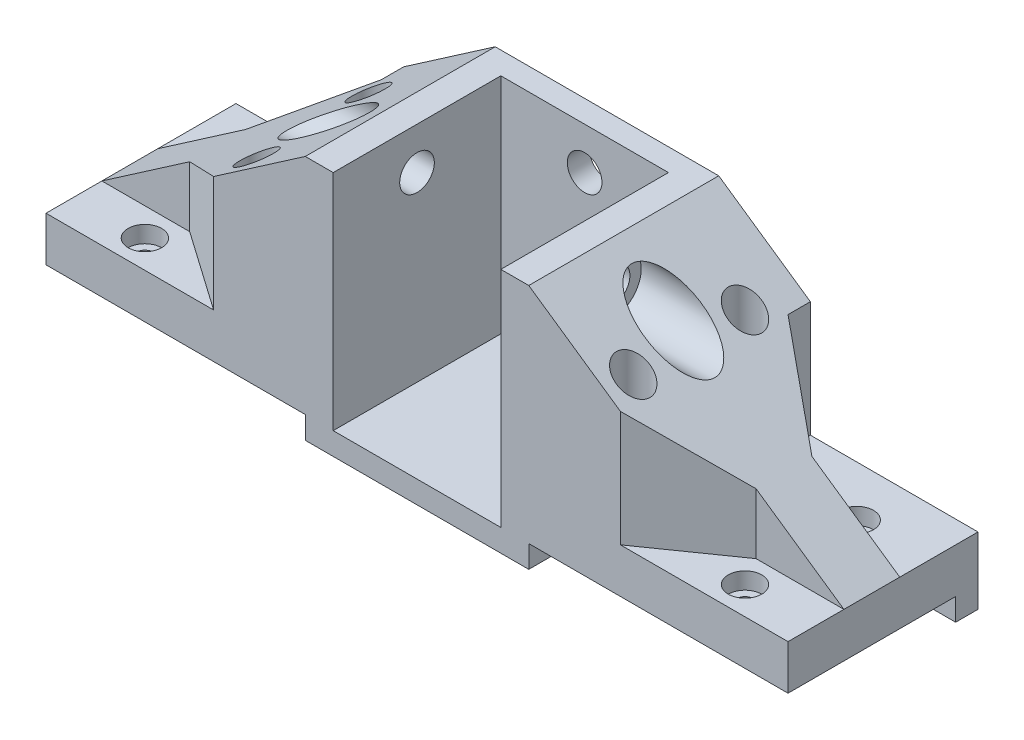
from build123d import *

# Parameters (mm, degrees)
SKETCH1_W               = 132.8
SKETCH1_H               = 44
BOSS_EXTRUDE1_DEPTH     = 4
BOSS_EXTRUDE2_DEPTH     = 30
BOSS_EXTRUDE3_DEPTH     = 15
CUT_EXTRUDE3_DEPTH      = 91.917325082
CUT_EXTRUDE3_DEPTH_BACK = 91.917325082
SKETCH6_R               = 3.1
SKETCH8_R               = 5.125
CUT_EXTRUDE5_DEPTH      = 96.419914064
SKETCH9_R               = 5.125
CUT_EXTRUDE6_DEPTH      = 96.419914064
CUT_EXTRUDE4_DEPTH      = 82.172409106
SKETCH3_R               = 1.6
CUT_EXTRUDE1_DEPTH      = 30
CUT_EXTRUDE2_DEPTH      = 82.172409106
CUT_EXTRUDE2_DEPTH_BACK = 3
SKETCH4_R               = 3
CUT_EXTRUDE7_DEPTH      = 77.11149716
SKETCH11_R              = 3.1
CUT_EXTRUDE8_DEPTH      = 77.11149716


with BuildPart() as part:
    # Sketch1 → Boss-Extrude1 (new body)
    with BuildSketch(Plane.XY):
        Rectangle(SKETCH1_W, SKETCH1_H)
    extrude(amount=BOSS_EXTRUDE1_DEPTH)

    # Sketch2 → Boss-Extrude2 (add)
    with BuildSketch(Plane.XY.offset(4)):
        Polygon((15, -18), (-15, -18), (-15, 22), (-20, 22), (-20, -10), (-66.4, -10), (-66.4, -18), (-20, -18), (-20, -22), (20, -22), (20, -18), (66.4, -18), (66.4, -10), (20, -10), (20, 22), (15, 22), align=None)
    extrude(amount=BOSS_EXTRUDE2_DEPTH)

    # Sketch5 → Boss-Extrude3 (add, symmetric)
    with BuildSketch(Plane.XY.offset(19)):
        Polygon((20, -10), (66.4, -10), (20, 22), align=None)
        Polygon((-20, 22), (-20, -10), (-66.4, -10), align=None)
    extrude(amount=BOSS_EXTRUDE3_DEPTH, both=True)

    # Sketch6 → Cut-Extrude3 (cut, two sides: drawn at the far end of the back side and taken through both)
    with BuildSketch(Plane(origin=(-15, 0, 0), x_dir=(0, 0, -1), z_dir=(1, 0, 0)).offset(-CUT_EXTRUDE3_DEPTH_BACK)):
        with Locations((-19, 14.5)):
            Circle(SKETCH6_R)
    extrude(amount=CUT_EXTRUDE3_DEPTH + CUT_EXTRUDE3_DEPTH_BACK, mode=Mode.SUBTRACT)

    # Sketch8 → Cut-Extrude5 (cut, through all)
    with BuildSketch(Plane(origin=(20, 0, 0), x_dir=(0, 0, -1), z_dir=(1, 0, 0))):
        with Locations((-19, 14.5)):
            Circle(SKETCH8_R)
    extrude(amount=CUT_EXTRUDE5_DEPTH, mode=Mode.SUBTRACT)

    # Sketch9 → Cut-Extrude6 (cut, through all)
    with BuildSketch(Plane.ZY.offset(20)):
        with Locations((19, 14.5)):
            Circle(SKETCH9_R)
    extrude(amount=CUT_EXTRUDE6_DEPTH, mode=Mode.SUBTRACT)

    # Sketch7 → Cut-Extrude4 (cut, through all)
    with BuildSketch(Plane(origin=(0, -10, 0), x_dir=(1, 0, 0), z_dir=(0, 1, 0))):
        Polygon((50.681480067, -14), (66.4, -14), (66.4, -4), (36.4, -4), align=None)
        Polygon((66.4, -34), (66.4, -24), (50.681480067, -24), (36.4, -34), align=None)
        Polygon((-66.4, -4), (-66.4, -14), (-50.681480067, -14), (-36.4, -4), align=None)
        Polygon((-50.681480067, -24), (-66.4, -24), (-66.4, -34), (-36.4, -34), align=None)
    extrude(amount=CUT_EXTRUDE4_DEPTH, mode=Mode.SUBTRACT)

    # Sketch3 → Cut-Extrude1 (cut)
    with BuildSketch(Plane(origin=(0, -10, 0), x_dir=(1, 0, 0), z_dir=(0, 1, 0))):
        with Locations((-53.7, -9)):
            Circle(SKETCH3_R)
        with Locations((-33.7, -29)):
            Circle(SKETCH3_R)
        with Locations((-33.7, -9)):
            Circle(SKETCH3_R)
        with Locations((-53.7, -29)):
            Circle(SKETCH3_R)
        with Locations((33.7, -9)):
            Circle(SKETCH3_R)
        with Locations((33.7, -29)):
            Circle(SKETCH3_R)
        with Locations((53.7, -29)):
            Circle(SKETCH3_R)
        with Locations((53.7, -9)):
            Circle(SKETCH3_R)
    extrude(amount=-CUT_EXTRUDE1_DEPTH, mode=Mode.SUBTRACT)

    # Sketch4 → Cut-Extrude2 (cut, two sides: drawn at the far end of the back side and taken through both)
    with BuildSketch(Plane(origin=(0, -10, 0), x_dir=(1, 0, 0), z_dir=(0, 1, 0)).offset(-CUT_EXTRUDE2_DEPTH_BACK)):
        with Locations((-53.7, -9)):
            Circle(SKETCH4_R)
        with Locations((-33.7, -9)):
            Circle(SKETCH4_R)
        with Locations((-33.7, -29)):
            Circle(SKETCH4_R)
        with Locations((-53.7, -29)):
            Circle(SKETCH4_R)
        with Locations((33.7, -9)):
            Circle(SKETCH4_R)
        with Locations((53.7, -9)):
            Circle(SKETCH4_R)
        with Locations((53.7, -29)):
            Circle(SKETCH4_R)
        with Locations((33.7, -29)):
            Circle(SKETCH4_R)
    extrude(amount=CUT_EXTRUDE2_DEPTH + CUT_EXTRUDE2_DEPTH_BACK, mode=Mode.SUBTRACT)

    # Sketch10 → Cut-Extrude7 (cut, through all)
    with BuildSketch(Plane.XY.offset(4)):
        Polygon((20, 22), (36.4, 10.689655172), (36.4, -10), (66.4, -10), (66.4, 22), align=None)
        Polygon((-66.4, 22), (-20, 22), (-36.4, 10.689655172), (-36.4, -10), (-66.4, -10), align=None)
    extrude(amount=-CUT_EXTRUDE7_DEPTH, mode=Mode.SUBTRACT)

    # Sketch11 → Cut-Extrude8 (cut, through all)
    with BuildSketch(Plane.XY.offset(4)):
        with Locations((0, 14.5)):
            Circle(SKETCH11_R)
    extrude(amount=-CUT_EXTRUDE8_DEPTH, mode=Mode.SUBTRACT)


solid = part.part
